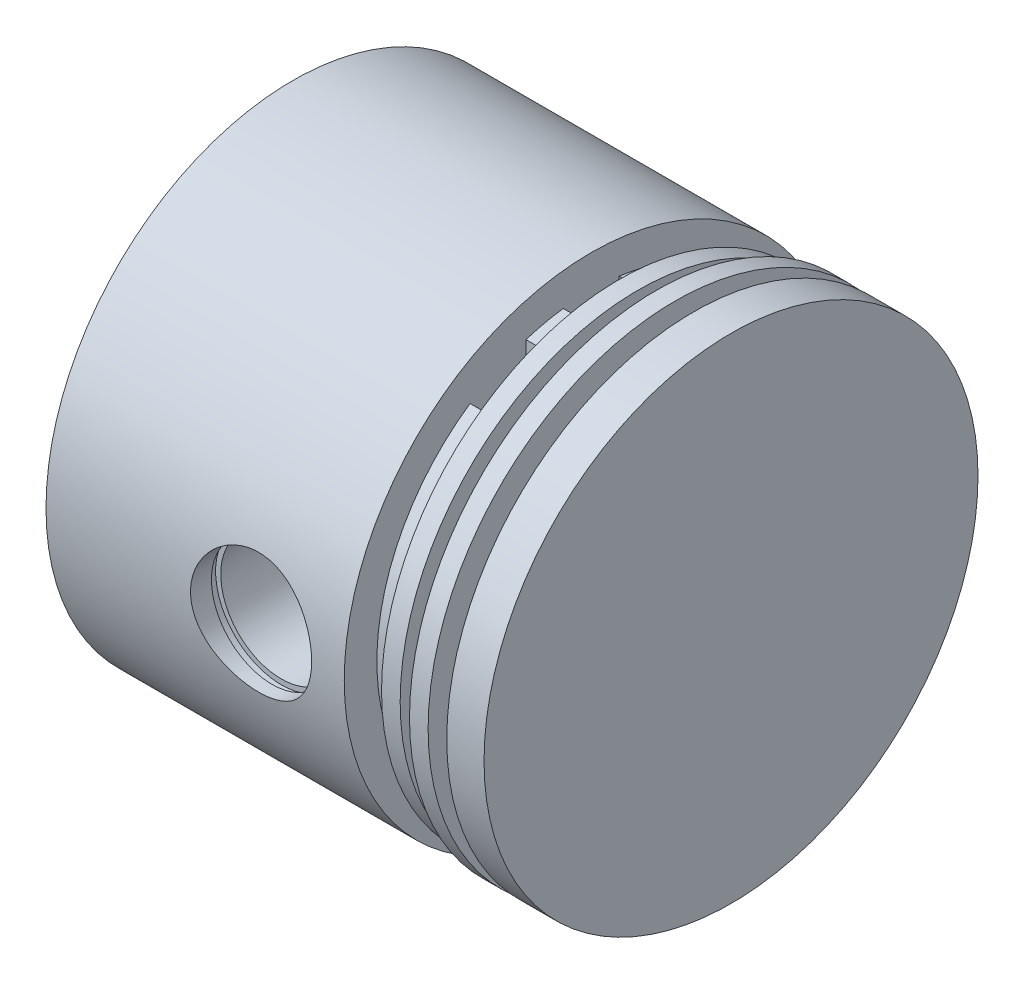
from build123d import *

# Parameters (mm, degrees)
SCHIZZO1_W                           = 47
SCHIZZO1_H                           = 26.5
TAGLIO_ESTRUSIONE1_DEPTH             = 43
SCHIZZO3_R                           = 6.5
TAGLIO_ESTRUSIONE2_DEPTH             = 64.420718194
TAGLIO_ESTRUSIONE3_REACH             = 65.421
TAGLIO_ESTRUSIONE3_END_RADIUS        = 24
ESTRUSIONE_ESTRUSIONE1_START         = -26.500000104
ESTRUSIONE_ESTRUSIONE1_2_DEPTH       = 53.000000208
RACCORDO1_R                          = 3
RACCORDO2_R                          = 3
RACCORDO3_R                          = 12
SCHIZZO40_W                          = 2
SCHIZZO40_H                          = 3
TAGLIO_ESTRUSIONE4_REACH             = 77.632
SCHIZZO41_W                          = 3
SCHIZZO41_H                          = 6
TAGLIO_ESTRUSIONE4_DIRECTION_2_DEPTH = 76.63233446
TAGLIO_ESTRUSIONE5_START             = -1
SCHIZZO44_R                          = 7.05
SCHIZZO44_R_2                        = 6.5
TAGLIO_ESTRUSIONE5_DEPTH             = 1


with BuildPart() as part:
    # Schizzo1 → Rivoluzione1 (revolve)
    with BuildSketch(Plane.XY, mode=Mode.PRIVATE) as rivoluzione1_sk:
        with Locations((23.5, 13.25)):
            Rectangle(SCHIZZO1_W, SCHIZZO1_H)
    revolve(rivoluzione1_sk.sketch.rotate(Axis((-51.070866142, 0, 0), (1, 0, 0)), 90), axis=Axis((-51.070866142, 0, 0), (1, 0, 0)))

    # Schizzo2 → Taglio-Estrusione1 (cut)
    with BuildSketch(Plane.ZY):
        with BuildLine():
            Line((-21.330729008, 11), (-6.830729008, 11))
            Line((-6.830729008, 11), (-6.830729008, -11))
            Line((-6.830729008, -11), (-21.330729008, -11))
            ThreePointArc((-21.330729008, -11), (0, -24), (21.330729008, -11))
            Line((21.330729008, -11), (6.830729008, -11))
            Line((6.830729008, -11), (6.830729008, 11))
            Line((6.830729008, 11), (21.330729008, 11))
            ThreePointArc((21.330729008, 11), (0, 24), (-21.330729008, 11))
        make_face()
    extrude(amount=-TAGLIO_ESTRUSIONE1_DEPTH, mode=Mode.SUBTRACT)

    # Schizzo3 → Taglio-Estrusione2 (cut, through all)
    with BuildSketch(Plane(origin=(0, 0, 6.830729008), x_dir=(-1, 0, 0), z_dir=(0, 0, -1))):
        with Locations(Location((-22, 0, 0), (0, 0, 90))):
            Circle(SCHIZZO3_R)
    taglio_estrusione2 = extrude(amount=-TAGLIO_ESTRUSIONE2_DEPTH, mode=Mode.SUBTRACT)

    # Specchia1: Taglio-Estrusione2 across plane
    add(taglio_estrusione2.mirror(Plane.XY), mode=Mode.SUBTRACT)

    # Taglio-Estrusione3: up to this cylinder (the profile starts inside it)
    taglio_estrusione3_end = Plane(origin=(11.250647, 0, 0), z_dir=(-1, 0, 0)) * Cylinder(TAGLIO_ESTRUSIONE3_END_RADIUS, 179.842, mode=Mode.PRIVATE)
    # Schizzo4 → Taglio-Estrusione3 (cut, up to the surface)
    with BuildSketch(Plane(origin=(0, 0, 6.830729008), x_dir=(-1, 0, 0), z_dir=(0, 0, -1)), mode=Mode.PRIVATE) as taglio_estrusione3_sk1:
        with BuildLine():
            Line((-22, 8.5), (-43, 11))
            Line((-43, 11), (0, 11))
            Line((0, 11), (0, -11))
            Line((0, -11), (-43, -11))
            Line((-43, -11), (-22, -8.5))
            ThreePointArc((-22, -8.5), (-13.5, 0), (-22, 8.5))
        make_face()
    taglio_estrusione3_tool1 = extrude(taglio_estrusione3_sk1.sketch, amount=-TAGLIO_ESTRUSIONE3_REACH, mode=Mode.PRIVATE) & taglio_estrusione3_end
    taglio_estrusione3 = taglio_estrusione3_tool1.solids().sort_by_distance((11.250647, 0, 6.830729))[0]
    add(taglio_estrusione3, mode=Mode.SUBTRACT)

    # Specchia2: Taglio-Estrusione3 across plane
    add(taglio_estrusione3.mirror(Plane.XY), mode=Mode.SUBTRACT)

    # Estrusione-Estrusione1: read off the stored shape, not the designer's step
    # Estrusione-Estrusione1 outline → Estrusione-Estrusione1 (revolve)
    with BuildSketch(Plane.YX):
        Polygon((22, 43), (19.61080581, 26), (24, 26), (24, 43), align=None)
    revolve(axis=Axis((0, 0, 0), (1, 0, 0)))

    # Estrusione-Estrusione1 2 outline → Estrusione-Estrusione1 2 (cut)
    with BuildSketch(Plane.XY.offset(ESTRUSIONE_ESTRUSIONE1_START)):
        with BuildLine():
            ThreePointArc((26, -5.123475383), (28.5, 0), (26, 5.123475383))
            Line((26, 5.123475383), (26, -5.123475383))
        make_face()
    extrude(amount=ESTRUSIONE_ESTRUSIONE1_2_DEPTH, mode=Mode.SUBTRACT)

    # Raccordo1
    raccordo1_edges = [part.edges().sort_by_distance(p)[0] for p in [
        (43, 19.052558883, -11),
    ]]
    fillet(raccordo1_edges, radius=RACCORDO1_R)

    # Raccordo2
    raccordo2_edges = [part.edges().sort_by_distance(p)[0] for p in [
        (43, -22, 0),
    ]]
    fillet(raccordo2_edges, radius=RACCORDO2_R)

    # Raccordo3
    # the kernel refuses this fillet: 12 mm, written as the material it takes off along each edge
    with BuildSketch(Plane(origin=(26, 0, 0), x_dir=(0, 0.7044646080071428, 0.7097391183141468), z_dir=(0, 0.7097391183141468, -0.7044646080071428))) as raccordo3_piece_1_section:
        with BuildLine():
            CenterArc((32.865343543, 8.087378059), RACCORDO3_R, 172, 50.372522858)
            Line((24, 0), (19.61080581, 0))
            Line((19.61080581, 0), (20.982126718, 9.75745527))
        make_face()
    raccordo3_piece_1 = revolve(axis=Axis((26, 0, 0), (1, 0, 0)), revolution_arc=269.572613517, mode=Mode.PRIVATE)
    raccordo3_piece_1 = split(raccordo3_piece_1, bisect_by=Plane(origin=(24.946338737, 8.850754612, 0), z_dir=(-0.11821288978511103, 0.992988274194944, 0)), keep=Keep.TOP, mode=Mode.PRIVATE)
    with BuildSketch(Plane(origin=(26, 0, 0), x_dir=(0, 0.7044646080071428, 0.7097391183141468), z_dir=(0, 0.7097391183141468, -0.7044646080071428))) as raccordo3_piece_2_section:
        with BuildLine():
            CenterArc((32.865343543, 8.087378059), RACCORDO3_R, 172, 50.372522858)
            Line((24, 0), (19.61080581, 0))
            Line((19.61080581, 0), (20.982126718, 9.75745527))
        make_face()
    raccordo3_piece_2 = revolve(axis=Axis((26, 0, 0), (1, 0, 0)), revolution_arc=269.572613517, mode=Mode.PRIVATE)
    raccordo3_piece_2 = split(raccordo3_piece_2, bisect_by=Plane(origin=(24.946338737, -8.850754612, 0), z_dir=(-0.11821288978511268, -0.9929882741949437, 0)), keep=Keep.TOP, mode=Mode.PRIVATE)
    with BuildSketch(Plane(origin=(26, 0, 0), x_dir=(0, -0.7044646080071435, 0.7097391183141462), z_dir=(0, -0.7097391183141462, -0.7044646080071435))) as raccordo3_piece_3_section:
        with BuildLine():
            CenterArc((32.865343543, -8.087378059), RACCORDO3_R, 137.627477142, 50.372522858)
            Line((20.982126718, -9.75745527), (19.61080581, 0))
            Line((19.61080581, 0), (24, 0))
        make_face()
    raccordo3_piece_3 = revolve(axis=Axis((26, 0, 0), (-1, 0, 0)), revolution_arc=269.572613517, mode=Mode.PRIVATE)
    raccordo3_piece_3 = split(raccordo3_piece_3, bisect_by=Plane(origin=(24.946338737, -8.850754612, 0), z_dir=(-0.11821288978511268, -0.9929882741949437, 0)), keep=Keep.TOP, mode=Mode.PRIVATE)
    with BuildSketch(Plane(origin=(26, 0, 0), x_dir=(0, -0.7044646080071435, 0.7097391183141462), z_dir=(0, -0.7097391183141462, -0.7044646080071435))) as raccordo3_piece_4_section:
        with BuildLine():
            CenterArc((32.865343543, -8.087378059), RACCORDO3_R, 137.627477142, 50.372522858)
            Line((20.982126718, -9.75745527), (19.61080581, 0))
            Line((19.61080581, 0), (24, 0))
        make_face()
    raccordo3_piece_4 = revolve(axis=Axis((26, 0, 0), (-1, 0, 0)), revolution_arc=269.572613517, mode=Mode.PRIVATE)
    raccordo3_piece_4 = split(raccordo3_piece_4, bisect_by=Plane(origin=(24.946338737, 8.850754612, 0), z_dir=(-0.11821288978511103, 0.992988274194944, 0)), keep=Keep.TOP, mode=Mode.PRIVATE)
    add([raccordo3_piece_1, raccordo3_piece_2, raccordo3_piece_3, raccordo3_piece_4], mode=Mode.SUBTRACT)

    # Schizzo40 → Taglia-Rivoluzione1 (revolve, cut)
    with BuildSketch(Plane(origin=(0, 0, 0), x_dir=(1, 0, 0), z_dir=(0, 1, 0))):
        with Locations((42, -25)):
            Rectangle(SCHIZZO40_W, SCHIZZO40_H)
        Polygon((39, -26.5), (39, -23.5), (37, -23.5), (37, -25.5), (35, -25.5), (35, -23), (32, -23), (32, -26.5), (34.912565124, -26.5), (37.75, -26.5), align=None)
    revolve(axis=Axis((0, 0, 0), (1, 0, 0)), mode=Mode.SUBTRACT)

    # Schizzo41 → Taglio-Estrusione4 (cut, up to next)
    with BuildSketch(Plane(origin=(0, -26.5, 0), x_dir=(-1, 0, 0), z_dir=(0, -1, 0)), mode=Mode.PRIVATE) as taglio_estrusione4_sk1:
        with Locations((-33.5, 0)):
            Rectangle(SCHIZZO41_W, SCHIZZO41_H)
    taglio_estrusione4_tool1 = extrude(taglio_estrusione4_sk1.sketch, amount=-TAGLIO_ESTRUSIONE4_REACH, mode=Mode.PRIVATE) & part.part
    # Schizzo41 → Taglio-Estrusione4 (cut, up to next)
    with BuildSketch(Plane(origin=(0, -26.5, 0), x_dir=(-1, 0, 0), z_dir=(0, -1, 0)), mode=Mode.PRIVATE) as taglio_estrusione4_sk2:
        with Locations((-33.5, 10)):
            Rectangle(SCHIZZO41_W, SCHIZZO41_H)
    taglio_estrusione4_tool2 = extrude(taglio_estrusione4_sk2.sketch, amount=-TAGLIO_ESTRUSIONE4_REACH, mode=Mode.PRIVATE) & part.part
    # Schizzo41 → Taglio-Estrusione4 (cut, up to next)
    with BuildSketch(Plane(origin=(0, -26.5, 0), x_dir=(-1, 0, 0), z_dir=(0, -1, 0)), mode=Mode.PRIVATE) as taglio_estrusione4_sk3:
        with Locations((-33.5, -10)):
            Rectangle(SCHIZZO41_W, SCHIZZO41_H)
    taglio_estrusione4_tool3 = extrude(taglio_estrusione4_sk3.sketch, amount=-TAGLIO_ESTRUSIONE4_REACH, mode=Mode.PRIVATE) & part.part
    taglio_estrusione4_1 = taglio_estrusione4_tool1.solids().sort_by_distance((33.5, -26.5, 0))[0]
    add(taglio_estrusione4_1, mode=Mode.SUBTRACT)
    taglio_estrusione4_2 = taglio_estrusione4_tool2.solids().sort_by_distance((33.5, -26.5, -10))[0]
    add(taglio_estrusione4_2, mode=Mode.SUBTRACT)
    taglio_estrusione4_3 = taglio_estrusione4_tool3.solids().sort_by_distance((33.5, -26.5, 10))[0]
    add(taglio_estrusione4_3, mode=Mode.SUBTRACT)
    taglio_estrusione4 = taglio_estrusione4_1 + taglio_estrusione4_2 + taglio_estrusione4_3  # Taglio-Estrusione4 as one shape, for the pattern or mirror that repeats it

    # Schizzo41 → Taglio-Estrusione4 direction 2 (cut)
    with BuildSketch(Plane(origin=(0, -26.5, 0), x_dir=(-1, 0, 0), z_dir=(0, -1, 0))):
        with Locations((-33.5, 0)):
            Rectangle(SCHIZZO41_W, SCHIZZO41_H)
        with Locations((-33.5, 10)):
            Rectangle(SCHIZZO41_W, SCHIZZO41_H)
        with Locations((-33.5, -10)):
            Rectangle(SCHIZZO41_W, SCHIZZO41_H)
    taglio_estrusione4_direction_2 = extrude(amount=TAGLIO_ESTRUSIONE4_DIRECTION_2_DEPTH, mode=Mode.SUBTRACT)

    # Specchia4: Taglio-Estrusione4, Taglio-Estrusione4 direction 2 across plane
    add(taglio_estrusione4.mirror(Plane.ZX), mode=Mode.SUBTRACT)
    add(taglio_estrusione4_direction_2.mirror(Plane.ZX), mode=Mode.SUBTRACT)

    # Schizzo44 → Taglio-Estrusione5 (cut)
    with BuildSketch(Plane.XY.offset(24.25).offset(TAGLIO_ESTRUSIONE5_START)):
        with Locations((22, 0)):
            Circle(SCHIZZO44_R)
        with Locations(Location((22, 0, 0), (0, 0, 90))):
            Circle(SCHIZZO44_R_2, mode=Mode.SUBTRACT)
    taglio_estrusione5 = extrude(amount=TAGLIO_ESTRUSIONE5_DEPTH, mode=Mode.SUBTRACT)

    # Specchia5: Taglio-Estrusione5 across plane
    add(taglio_estrusione5.mirror(Plane.XY), mode=Mode.SUBTRACT)


solid = part.part
